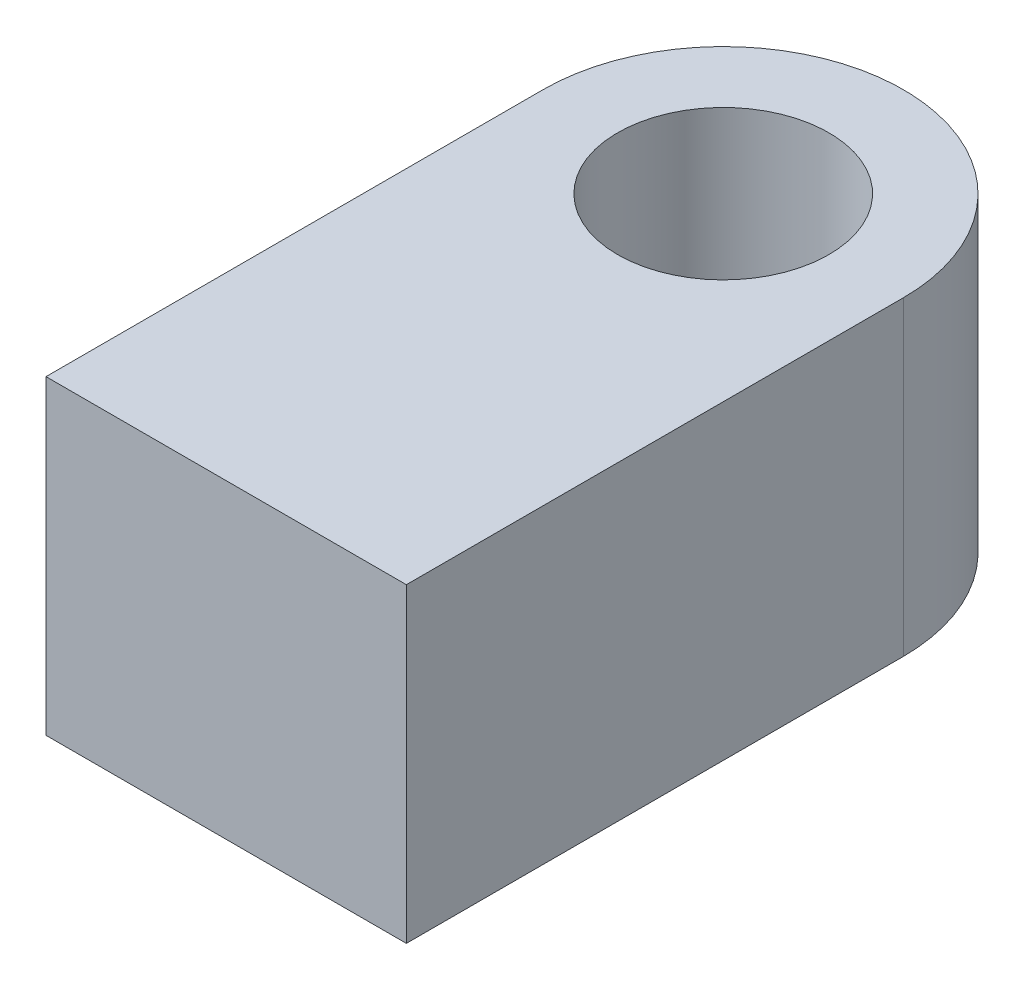
from build123d import *

# Parameters (mm, degrees)
SKETCH1_R           = 8.5
BOSS_EXTRUDE1_DEPTH = 25


with BuildPart() as part:
    # Sketch1 → Boss-Extrude1 (new body)
    with BuildSketch(Plane(origin=(0, 0, 0), x_dir=(1, 0, 0), z_dir=(0, 1, 0))):
        with BuildLine():
            Line((-14.5, 0), (-14.5, -40))
            Line((-14.5, -40), (14.5, -40))
            Line((14.5, -40), (14.5, 0))
            ThreePointArc((14.5, 0), (0, 14.5), (-14.5, 0))
        make_face()
        Circle(SKETCH1_R, mode=Mode.SUBTRACT)
    extrude(amount=BOSS_EXTRUDE1_DEPTH)


solid = part.part
